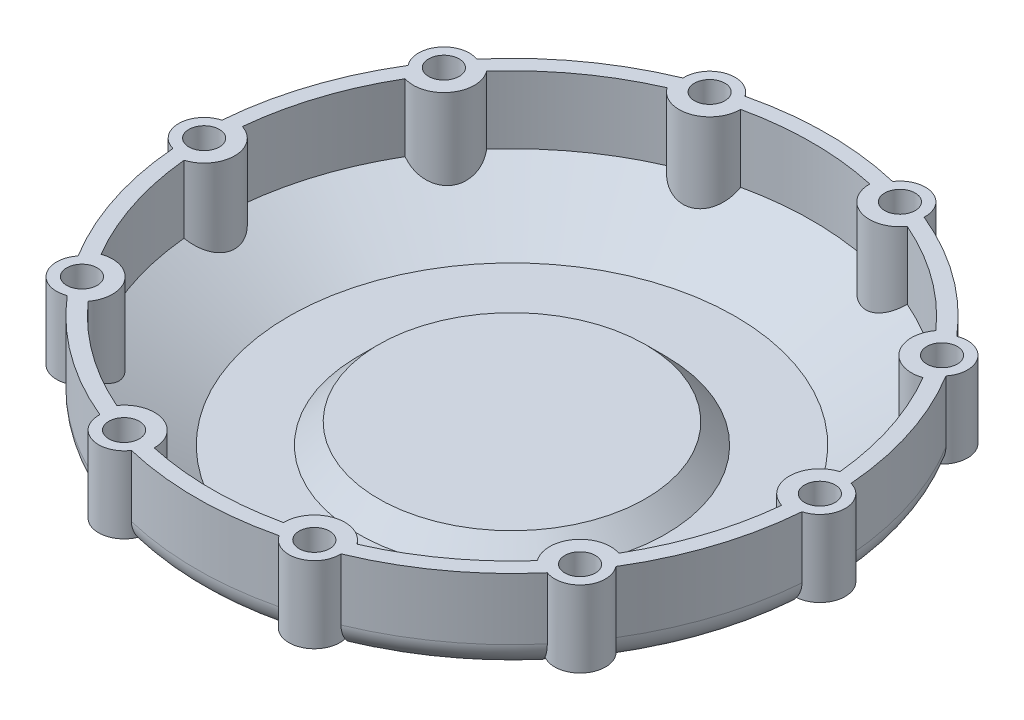
from build123d import *

# Parameters (mm, degrees)
FILLET1_R           = 5
FILLET3_R           = 5
SKETCH2_6_R         = 5
CUT_EXTRUDE2_DEPTH  = 92.175655934
SKETCH2_R           = 5
BOSS_EXTRUDE1_DEPTH = 15
BOSS_EXTRUDE3_REACH = 95.591
SKETCH2_4_R         = 3
CUT_EXTRUDE1_DEPTH  = 94.590865075
CIRPATTERN1_COUNT   = 10
SKETCH4_R           = 1
CIRPATTERN2_COUNT   = 10


with BuildPart() as part:
    # Sketch1 → Revolve1 (revolve)
    with BuildSketch(Plane.YZ):
        Polygon((0, 62), (15, 62), (15, 59), (1.732050808, 59), (-7, 43.875644347), (-7, 30.242640687), (-3, 26.242640687), (-3, 0), (-6, 0), (-6, 25), (-10, 29), (-10, 44.679491924), align=None)
    revolve(axis=Axis((0, -99.966688733, 0), (0, 1, 0)))

    # Fillet1
    fillet1_edges = [part.edges().sort_by_distance(p)[0] for p in [
        (0, -10, -44.679491924),
        (0, -10, -29),
        (0, -6, -25),
    ]]
    fillet(fillet1_edges, radius=FILLET1_R)

    # Fillet3
    fillet3_edges = [part.edges().sort_by_distance(p)[0] for p in [
        (0, 0, -62),
    ]]
    fillet(fillet3_edges, radius=FILLET3_R)

    # Sketch2<6> → Cut-Extrude2 (cut, through all)
    with BuildSketch(Plane(origin=(0, 15, 0), x_dir=(-1, 0, 0), z_dir=(0, 1, 0))):
        with Locations((-60.5, 0)):
            Circle(SKETCH2_6_R)
    cut_extrude2 = extrude(amount=-CUT_EXTRUDE2_DEPTH, mode=Mode.SUBTRACT)

    # Sketch2 → Boss-Extrude1 (add)
    with BuildSketch(Plane(origin=(0, 15, 0), x_dir=(-1, 0, 0), z_dir=(0, 1, 0))):
        with Locations((-60.5, 0)):
            Circle(SKETCH2_R)
    boss_extrude1 = extrude(amount=-BOSS_EXTRUDE1_DEPTH)

    # Boss-Extrude3: up to this cone (the profile starts inside it)
    boss_extrude3_end = Plane(origin=(0, 15, 0), z_dir=(0, 1, 0)).offset(-47.331614075) * Cone(1.732e-06, 390.410101487, 225.403376188, align=(Align.CENTER, Align.CENTER, Align.MIN), mode=Mode.PRIVATE)
    # Sketch2<3> → Boss-Extrude3 (add, up to the surface)
    with BuildSketch(Plane(origin=(0, 15, 0), x_dir=(-1, 0, 0), z_dir=(0, 1, 0)), mode=Mode.PRIVATE) as boss_extrude3_sk1:
        with BuildLine():
            ThreePointArc((-60.29338843, -4.995729342), (-60.249995722, -5.494362153), (-60.202479339, -5.992618915))
            ThreePointArc((-60.202479339, -5.992618915), (-54.5, 0), (-60.202479339, 5.992618915))
            ThreePointArc((-60.202479339, 5.992618915), (-60.249995722, 5.494362153), (-60.29338843, 4.995729342))
            ThreePointArc((-60.29338843, 4.995729342), (-55.5, 0), (-60.29338843, -4.995729342))
        make_face()
    boss_extrude3_tool1 = extrude(boss_extrude3_sk1.sketch, amount=-BOSS_EXTRUDE3_REACH, mode=Mode.PRIVATE) & boss_extrude3_end
    boss_extrude3 = boss_extrude3_tool1.solids().sort_by_distance((54.63312, 15, 0))[0]
    add(boss_extrude3)

    # Sketch2<4> → Cut-Extrude1 (cut, through all)
    with BuildSketch(Plane(origin=(0, 15, 0), x_dir=(-1, 0, 0), z_dir=(0, 1, 0))):
        with Locations((-60.5, 0)):
            Circle(SKETCH2_4_R)
    cut_extrude1 = extrude(amount=-CUT_EXTRUDE1_DEPTH, mode=Mode.SUBTRACT)

    # CirPattern1: Cut-Extrude2, Boss-Extrude1, Boss-Extrude3, Cut-Extrude1 ×10 about axis
    cirpattern1_axis = Axis((0, 2.886751346, 0), (0, 1, 0))
    add([cut_extrude2.rotate(cirpattern1_axis, i * 360 / CIRPATTERN1_COUNT) for i in range(1, CIRPATTERN1_COUNT)], mode=Mode.SUBTRACT)
    add([boss_extrude1.rotate(cirpattern1_axis, i * 360 / CIRPATTERN1_COUNT) for i in range(1, CIRPATTERN1_COUNT)])
    add([boss_extrude3.rotate(cirpattern1_axis, i * 360 / CIRPATTERN1_COUNT) for i in range(1, CIRPATTERN1_COUNT)])
    add([cut_extrude1.rotate(cirpattern1_axis, i * 360 / CIRPATTERN1_COUNT) for i in range(1, CIRPATTERN1_COUNT)], mode=Mode.SUBTRACT)

    # Sweep1: sweep along a path in Sketch3
    with BuildLine(Plane(origin=(0, 0, 0), x_dir=(0, 1, 0), z_dir=(0, 0, 1))) as sweep1_path:
        Line((-3.75277675, -55.5), (-9.330127019, -45.839745962))
        ThreePointArc((-9.330127019, -45.839745962), (-9.829629131, -44.633841188), (-10, -43.339745962))
        Line((-10, -43.339745962), (-10, -31.071067812))
        ThreePointArc((-10, -31.071067812), (-9.619397663, -29.15765065), (-8.535533906, -27.535533906))
        Line((-8.535533906, -27.535533906), (-7.464466094, -26.464466094))
        ThreePointArc((-7.464466094, -26.464466094), (-6.380602337, -24.84234935), (-6, -22.928932188))
        Line((-6, -22.928932188), (-6, 0))
    # Sketch4 → Sweep1 (sweep)
    with BuildSketch(Plane.YZ.offset(55.5)):
        with Locations((-3.759882225, 0)):
            Circle(SKETCH4_R)
    sweep1 = sweep(path=sweep1_path.line)

    # CirPattern2: Sweep1 ×10 about axis
    cirpattern2_axis = Axis((0, -1.443375673, 0), (0, -1, 0))
    for i in range(1, CIRPATTERN2_COUNT):
        add(sweep1.rotate(cirpattern2_axis, i * 360 / CIRPATTERN2_COUNT))


solid = part.part
